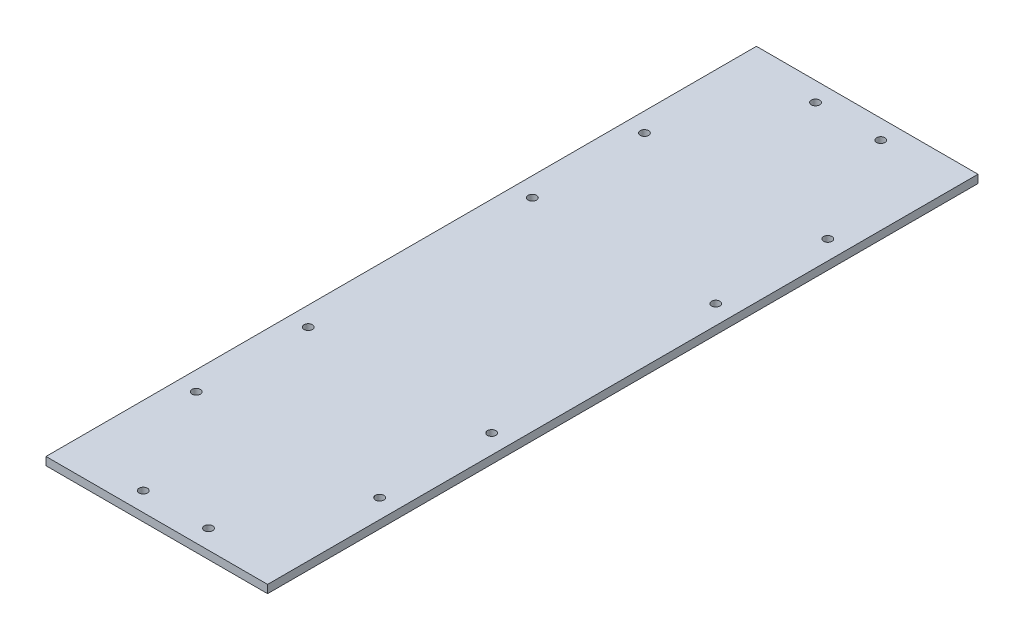
from build123d import *

# Parameters (mm, degrees)
SKETCH1_W           = 87.15
SKETCH1_H           = 279.4
SKETCH1_R           = 1.65
BOSS_EXTRUDE1_DEPTH = 3.175


with BuildPart() as part:
    # Sketch1 → Boss-Extrude1 (new body)
    with BuildSketch(Plane(origin=(0, 0, 0), x_dir=(1, 0, 0), z_dir=(0, 1, 0))):
        Rectangle(SKETCH1_W, SKETCH1_H)
        with Locations((-12.835, 132.2)):
            Circle(SKETCH1_R, mode=Mode.SUBTRACT)
        with Locations((-36.075, 88.133333333)):
            Circle(SKETCH1_R, mode=Mode.SUBTRACT)
        with Locations((-36.075, 44.066666667)):
            Circle(SKETCH1_R, mode=Mode.SUBTRACT)
        with Locations((36.075, 44.066666667)):
            Circle(SKETCH1_R, mode=Mode.SUBTRACT)
        with Locations((36.075, 88.133333333)):
            Circle(SKETCH1_R, mode=Mode.SUBTRACT)
        with Locations((12.835, 132.2)):
            Circle(SKETCH1_R, mode=Mode.SUBTRACT)
        with Locations((12.835, -132.2)):
            Circle(SKETCH1_R, mode=Mode.SUBTRACT)
        with Locations((36.075, -88.133333333)):
            Circle(SKETCH1_R, mode=Mode.SUBTRACT)
        with Locations((36.075, -44.066666667)):
            Circle(SKETCH1_R, mode=Mode.SUBTRACT)
        with Locations((-36.075, -44.066666667)):
            Circle(SKETCH1_R, mode=Mode.SUBTRACT)
        with Locations((-36.075, -88.133333333)):
            Circle(SKETCH1_R, mode=Mode.SUBTRACT)
        with Locations((-12.835, -132.2)):
            Circle(SKETCH1_R, mode=Mode.SUBTRACT)
    extrude(amount=BOSS_EXTRUDE1_DEPTH)


solid = part.part
